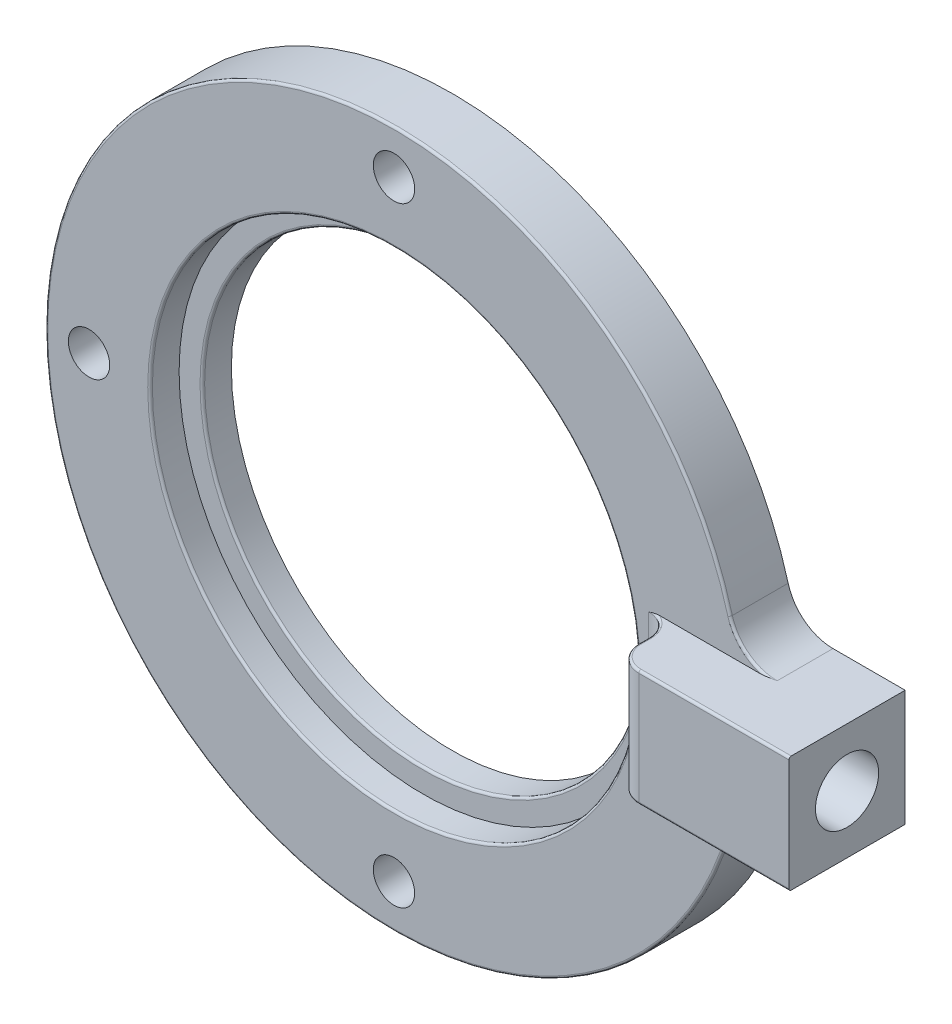
from build123d import *

# Parameters (mm, degrees)
SKETCH1_R           = 19.05
BOSS_EXTRUDE1_DEPTH = 3.175
SKETCH2_R           = 12.065
CUT_EXTRUDE1_DEPTH  = 28.127211891
SKETCH3_R           = 13.335
CUT_EXTRUDE2_DEPTH  = 1.5875
BOSS_EXTRUDE2_START = 15.24
SKETCH4_W           = 6.35
SKETCH4_H           = 6.35
BOSS_EXTRUDE2_DEPTH = 9.525
FILLET1_R           = 2.54
SKETCH5_R           = 1.7272
CUT_EXTRUDE3_DEPTH  = 7.62
FILLET2_R           = 1.3208
FILLET3_R           = 0.127
SKETCH6_R           = 1.1303
CUT_EXTRUDE4_DEPTH  = 32.405228218


with BuildPart() as part:
    # Sketch1 → Boss-Extrude1 (new body)
    with BuildSketch(Plane.XY):
        Circle(SKETCH1_R)
    extrude(amount=BOSS_EXTRUDE1_DEPTH)

    # Sketch2 → Cut-Extrude1 (cut, through all)
    with BuildSketch(Plane.XY.offset(3.175)):
        Circle(SKETCH2_R)
    extrude(amount=-CUT_EXTRUDE1_DEPTH, mode=Mode.SUBTRACT)

    # Sketch3 → Cut-Extrude2 (cut)
    with BuildSketch(Plane.XY.offset(3.175)):
        Circle(SKETCH3_R)
    extrude(amount=-CUT_EXTRUDE2_DEPTH, mode=Mode.SUBTRACT)

    # Sketch4 → Boss-Extrude2 (add)
    with BuildSketch(Plane(origin=(0, 0, 0), x_dir=(0, 0, -1), z_dir=(1, 0, 0)).offset(BOSS_EXTRUDE2_START)):
        with Locations((-3.175, 0)):
            Rectangle(SKETCH4_W, SKETCH4_H)
    extrude(amount=BOSS_EXTRUDE2_DEPTH)

    # Fillet1
    fillet1_edges = [part.edges().sort_by_distance(p)[0] for p in [
        (18.783553311, -3.175, 1.5875),
        (18.783553311, 3.175, 1.5875),
    ]]
    fillet(fillet1_edges, radius=FILLET1_R)

    # Sketch5 → Cut-Extrude3 (cut)
    with BuildSketch(Plane(origin=(24.765, 0, 0), x_dir=(0, 0, -1), z_dir=(1, 0, 0))):
        with Locations((-3.175, 0)):
            Circle(SKETCH5_R)
    extrude(amount=-CUT_EXTRUDE3_DEPTH, mode=Mode.SUBTRACT)

    # Fillet2
    fillet2_edges = [part.edges().sort_by_distance(p)[0] for p in [
        (15.24, 0, 3.175),
        (15.24, 0, 6.35),
    ]]
    fillet(fillet2_edges, radius=FILLET2_R)

    # Fillet3
    # the kernel refuses this fillet: 0.127 mm, written as the material it takes off along each edge
    with BuildSketch(Plane(origin=(0, 0, 3.175), x_dir=(1, 0, 0), z_dir=(0, -1, 0))) as fillet3_piece_1:
        with BuildLine():
            CenterArc((13.335 + FILLET3_R, -FILLET3_R), FILLET3_R, 90, 90)
            Line((13.335, -FILLET3_R), (13.335, 0))
            Line((13.335, 0), (13.335 + FILLET3_R, 0))
        make_face()
    revolve(axis=Axis((0, 0, 3.175), (0, 0, 1)), mode=Mode.SUBTRACT)
    with BuildSketch(Plane(origin=(0, 0, 1.5875), x_dir=(1, 0, 0), z_dir=(0, -1, 0))) as fillet3_piece_2:
        with BuildLine():
            CenterArc((12.065 + FILLET3_R, -FILLET3_R), FILLET3_R, 90, 90)
            Line((12.065, -FILLET3_R), (12.065, 0))
            Line((12.065, 0), (12.065 + FILLET3_R, 0))
        make_face()
    revolve(axis=Axis((0, 0, 1.5875), (0, 0, 1)), mode=Mode.SUBTRACT)
    with BuildSketch(Plane(origin=(16.5608, -3.175, 6.35), x_dir=(0, 0, -1), z_dir=(1, 0, 0))) as fillet3_piece_3:
        with BuildLine():
            CenterArc((FILLET3_R, FILLET3_R), FILLET3_R, 180, 90)
            Line((0, FILLET3_R), (0, 0))
            Line((0, 0), (FILLET3_R, 0))
        make_face()
    extrude(amount=8.5217, mode=Mode.SUBTRACT)
    with BuildSketch(Plane(origin=(16.5608, 3.175, 6.35), x_dir=(0, 0, -1), z_dir=(1, 0, 0))) as fillet3_piece_4:
        with BuildLine():
            CenterArc((FILLET3_R, -FILLET3_R), FILLET3_R, 90, 90)
            Line((0, -FILLET3_R), (0, 0))
            Line((0, 0), (FILLET3_R, 0))
        make_face()
    extrude(amount=8.5217, mode=Mode.SUBTRACT)
    with BuildSketch(Plane(origin=(0, 0, 3.175), x_dir=(0.9643291947502942, 0.2647058823529412, 0), z_dir=(0.2647058823529412, -0.9643291947502942, 0))) as fillet3_piece_5:
        with BuildLine():
            CenterArc((19.05 - FILLET3_R, -FILLET3_R), FILLET3_R, 0, 90)
            Line((19.05 - FILLET3_R, 0), (19.05, 0))
            Line((19.05, 0), (19.05, -FILLET3_R))
        make_face()
    revolve(axis=Axis((0, 0, 3.175), (0, 0, 1)), revolution_arc=329.301045966, mode=Mode.SUBTRACT)
    with BuildSketch(Plane(origin=(20.819867315, 5.715, 3.175), x_dir=(0.12470900704731759, -0.9921933599663284, 0), z_dir=(0.9921933599663284, 0.12470900704731759, 0))) as fillet3_piece_6_section:
        with BuildLine():
            CenterArc((2.54 + FILLET3_R, FILLET3_R), FILLET3_R, 180, 90)
            Line((2.54, FILLET3_R), (2.54, 0))
            Line((2.54, 0), (2.54 + FILLET3_R, 0))
        make_face()
    fillet3_piece_6 = revolve(axis=Axis((20.819867315, 5.715, 3.175), (0, 0, -1)), revolution_arc=81.814474605, mode=Mode.PRIVATE)
    fillet3_piece_6 = split(fillet3_piece_6, bisect_by=Plane(origin=(19.258112291, 3.175, 3.13928763), z_dir=(0, 1, 0)), keep=Keep.TOP, mode=Mode.PRIVATE)
    add(fillet3_piece_6, mode=Mode.SUBTRACT)
    with BuildSketch(Plane(origin=(20.819867315, -5.715, 3.175), x_dir=(0.12470900704731899, 0.9921933599663282, 0), z_dir=(0.9921933599663282, -0.12470900704731899, 0))) as fillet3_piece_7_section:
        with BuildLine():
            CenterArc((2.54 + FILLET3_R, -FILLET3_R), FILLET3_R, 90, 90)
            Line((2.54 + FILLET3_R, 0), (2.54, 0))
            Line((2.54, 0), (2.54, -FILLET3_R))
        make_face()
    fillet3_piece_7 = revolve(axis=Axis((20.819867315, -5.715, 3.175), (0, 0, 1)), revolution_arc=81.814474605, mode=Mode.PRIVATE)
    fillet3_piece_7 = split(fillet3_piece_7, bisect_by=Plane(origin=(19.258112291, -3.175, 3.13928763), z_dir=(0, -1, 0)), keep=Keep.TOP, mode=Mode.PRIVATE)
    add(fillet3_piece_7, mode=Mode.SUBTRACT)
    with BuildSketch(Plane(origin=(15.24, -3.175, 4.4958), x_dir=(1, 0, 0), z_dir=(0, 0, 1)), Plane(origin=(15.24, 3.175, 5.0292), x_dir=(1, 0, 0), z_dir=(0, 0, -1))) as fillet3_piece_8:
        with BuildLine():
            CenterArc((FILLET3_R, FILLET3_R), FILLET3_R, 180, 90)
            Line((0, FILLET3_R), (0, 0))
            Line((0, 0), (FILLET3_R, 0))
        make_face()
    extrude(amount=0.5334, mode=Mode.SUBTRACT)
    with BuildSketch(Plane(origin=(16.5608, -3.175, 5.0292), x_dir=(-1, 0, 0), z_dir=(0, 0, -1))) as fillet3_piece_9:
        with BuildLine():
            CenterArc((1.3208 - FILLET3_R, FILLET3_R), FILLET3_R, 270, 90)
            Line((1.3208, FILLET3_R), (1.3208, 0))
            Line((1.3208, 0), (1.3208 - FILLET3_R, 0))
        make_face()
    revolve(axis=Axis((16.5608, -3.175, 5.0292), (0, 1, 0)), revolution_arc=90, mode=Mode.SUBTRACT)
    with BuildSketch(Plane(origin=(16.5608, 3.175, 5.0292), x_dir=(-1, 0, 0), z_dir=(0, 0, -1))) as fillet3_piece_10:
        with BuildLine():
            CenterArc((1.3208 - FILLET3_R, -FILLET3_R), FILLET3_R, 0, 90)
            Line((1.3208, -FILLET3_R), (1.3208, 0))
            Line((1.3208, 0), (1.3208 - FILLET3_R, 0))
        make_face()
    revolve(axis=Axis((16.5608, 3.175, 5.0292), (0, 1, 0)), revolution_arc=90, mode=Mode.SUBTRACT)
    with BuildSketch(Plane(origin=(13.9192, 3.175, 4.4958), x_dir=(-0.23816998714710041, 0, -0.9712234846946144), z_dir=(-0.9712234846946144, 0, 0.23816998714710041))) as fillet3_piece_11_section:
        with BuildLine():
            CenterArc((1.3208 + FILLET3_R, FILLET3_R), FILLET3_R, 180, 90)
            Line((1.3208, FILLET3_R), (1.3208, 0))
            Line((1.3208, 0), (1.3208 + FILLET3_R, 0))
        make_face()
    fillet3_piece_11 = revolve(axis=Axis((13.9192, 3.175, 4.4958), (0, -1, 0)), revolution_arc=103.778556657, mode=Mode.PRIVATE)
    fillet3_piece_11 = split(fillet3_piece_11, bisect_by=Plane(origin=(14.878561501, 3.139057971, 3.175), z_dir=(0, 0, 1)), keep=Keep.TOP, mode=Mode.PRIVATE)
    add(fillet3_piece_11, mode=Mode.SUBTRACT)
    with BuildSketch(Plane(origin=(13.9192, -3.175, 4.4958), x_dir=(-0.23816998714710186, 0, -0.9712234846946141), z_dir=(-0.9712234846946141, 0, 0.23816998714710186))) as fillet3_piece_12_section:
        with BuildLine():
            CenterArc((1.3208 + FILLET3_R, -FILLET3_R), FILLET3_R, 90, 90)
            Line((1.3208 + FILLET3_R, 0), (1.3208, 0))
            Line((1.3208, 0), (1.3208, -FILLET3_R))
        make_face()
    fillet3_piece_12 = revolve(axis=Axis((13.9192, -3.175, 4.4958), (0, -1, 0)), revolution_arc=103.778556657, mode=Mode.PRIVATE)
    fillet3_piece_12 = split(fillet3_piece_12, bisect_by=Plane(origin=(14.878561477, -3.139057971, 3.175), z_dir=(0, 0, 1)), keep=Keep.TOP, mode=Mode.PRIVATE)
    add(fillet3_piece_12, mode=Mode.SUBTRACT)

    # Sketch6 → Cut-Extrude4 (cut, through all)
    with BuildSketch(Plane.XY.offset(3.175)):
        with Locations((-16.66875, 0)):
            Circle(SKETCH6_R)
        with Locations((0, 16.66875)):
            Circle(SKETCH6_R)
        with Locations((0, -16.66875)):
            Circle(SKETCH6_R)
    extrude(amount=-CUT_EXTRUDE4_DEPTH, mode=Mode.SUBTRACT)


solid = part.part
